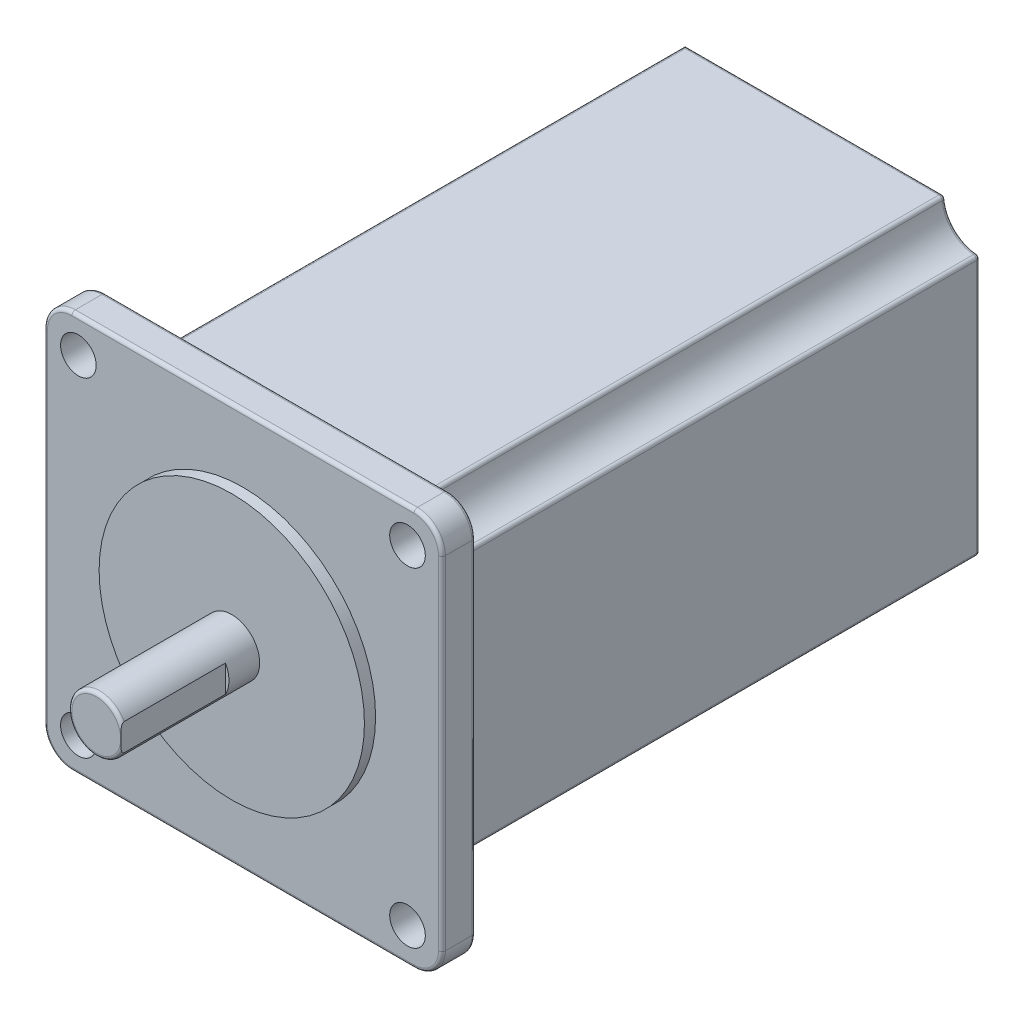
from build123d import *

# Parameters (mm, degrees)
IZIM1_R                     = 19.05
IZIM1_R_2                   = 2.55
IZIM1_R_3                   = 4
Y_KSEKLIK_EKSTR_ZYON1_DEPTH = 4.8
Y_KSEKLIK_EKSTR_ZYON2_DEPTH = 1.6
IZIM3_R                     = 4
Y_KSEKLIK_EKSTR_ZYON3_DEPTH = 19.4
KES_EKSTR_ZYON1_DEPTH       = 15
Y_KSEKLIK_EKSTR_ZYON4_DEPTH = 77.2
RADYUS1_R                   = 0.5


with BuildPart() as part:
    # Çizim1 → Yükseklik-Ekstrüzyon1 (new body)
    # profile 1 of 3: a face of its own
    with BuildSketch(Plane.XY):
        with BuildLine():
            Line((-34.313511383, 32.517298381), (14.686488617, 32.517298381))
            ThreePointArc((14.686488617, 32.517298381), (17.514915741, 31.345725506), (18.686488617, 28.517298381))
            Line((18.686488617, 28.517298381), (18.686488617, -20.482701619))
            ThreePointArc((18.686488617, -20.482701619), (17.514915741, -23.311128744), (14.686488617, -24.482701619))
            Line((14.686488617, -24.482701619), (-34.313511383, -24.482701619))
            ThreePointArc((-34.313511383, -24.482701619), (-37.141938508, -23.311128744), (-38.313511383, -20.482701619))
            Line((-38.313511383, -20.482701619), (-38.313511383, 28.517298381))
            ThreePointArc((-38.313511383, 28.517298381), (-37.141938508, 31.345725506), (-34.313511383, 32.517298381))
        make_face()
        with Locations((-9.813511383, 4.017298381)):
            Circle(IZIM1_R, mode=Mode.SUBTRACT)
        with Locations((13.756488617, 27.587298381)):
            Circle(IZIM1_R_2, mode=Mode.SUBTRACT)
        with Locations((13.756488617, -19.552701619)):
            Circle(IZIM1_R_2, mode=Mode.SUBTRACT)
        with Locations((-33.383511383, -19.552701619)):
            Circle(IZIM1_R_2, mode=Mode.SUBTRACT)
        with Locations((-33.383511383, 27.587298381)):
            Circle(IZIM1_R_2, mode=Mode.SUBTRACT)
    # profile 2 of 3: a face of its own
    with BuildSketch(Plane.XY):
        with Locations((-9.813511383, 4.017298381)):
            Circle(IZIM1_R)
        with Locations((-9.813511383, 4.017298381)):
            Circle(IZIM1_R_3, mode=Mode.SUBTRACT)
    # profile 3 of 3: a face of its own
    with BuildSketch(Plane.XY):
        with Locations((-9.813511383, 4.017298381)):
            Circle(IZIM1_R_3)
    extrude(amount=-Y_KSEKLIK_EKSTR_ZYON1_DEPTH)

    # Çizim2 → Yükseklik-Ekstrüzyon2 (add)
    with BuildSketch(Plane.XY):
        with BuildLine():
            ThreePointArc((9.186488617, 4.017298381), (3.621517459, 17.452327223), (-9.813511383, 23.017298381))
            Line((-9.813511383, 23.017298381), (-9.813511383, -14.982701619))
            ThreePointArc((-9.813511383, -14.982701619), (3.621517459, -9.417730462), (9.186488617, 4.017298381))
        make_face()
        with BuildLine():
            Line((-9.813511383, -14.982701619), (-9.813511383, 23.017298381))
            ThreePointArc((-9.813511383, 23.017298381), (-28.813511383, 4.017298381), (-9.813511383, -14.982701619))
        make_face()
    extrude(amount=Y_KSEKLIK_EKSTR_ZYON2_DEPTH)

    # Çizim3 → Yükseklik-Ekstrüzyon3 (add)
    with BuildSketch(Plane.XY.offset(1.6)):
        with Locations((-9.813511383, 4.017298381)):
            Circle(IZIM3_R)
    extrude(amount=Y_KSEKLIK_EKSTR_ZYON3_DEPTH)

    # Çizim4 → Kes-Ekstrüzyon1 (cut)
    with BuildSketch(Plane.XY.offset(21)):
        Polygon((-6.313511383, 4.017298381), (-6.313511383, 6.245974497), (-5.024546615, 6.245974497), (-5.024546615, 1.577201368), (-6.313511383, 1.577201368), align=None)
    extrude(amount=-KES_EKSTR_ZYON1_DEPTH, mode=Mode.SUBTRACT)

    # Çizim5 → Yükseklik-Ekstrüzyon4 (add)
    with BuildSketch(Plane(origin=(0, 0, -4.8), x_dir=(-1, 0, 0), z_dir=(0, 0, -1))):
        with BuildLine():
            ThreePointArc((-8.826488617, 27.587298381), (-10.270452185, 24.10126195), (-13.756488617, 22.657298381))
            Line((-13.756488617, 22.657298381), (-13.756488617, -14.622701619))
            ThreePointArc((-13.756488617, -14.622701619), (-10.270452185, -16.066665188), (-8.826488617, -19.552701619))
            Line((-8.826488617, -19.552701619), (28.453511383, -19.552701619))
            ThreePointArc((28.453511383, -19.552701619), (29.897474952, -16.066665188), (33.383511383, -14.622701619))
            Line((33.383511383, -14.622701619), (33.383511383, 22.657298381))
            ThreePointArc((33.383511383, 22.657298381), (29.897474952, 24.10126195), (28.453511383, 27.587298381))
            Line((28.453511383, 27.587298381), (-8.826488617, 27.587298381))
        make_face()
    extrude(amount=Y_KSEKLIK_EKSTR_ZYON4_DEPTH)

    # Radyus1
    radyus1_edges = [part.edges().sort_by_distance(p)[0] for p in [
        (-37.141938508, 31.345725506, -4.8),
        (-38.313511383, 4.017298381, -4.8),
        (-37.141938508, -23.311128744, -4.8),
        (-9.813511383, -24.482701619, -4.8),
        (17.514915741, -23.311128744, -4.8),
        (18.686488617, 4.017298381, -4.8),
        (17.514915741, 31.345725506, -4.8),
        (-37.141938508, 31.345725506, 0),
        (-38.313511383, 4.017298381, 0),
        (-37.141938508, -23.311128744, 0),
        (-9.813511383, -24.482701619, 0),
        (17.514915741, -23.311128744, 0),
        (18.686488617, 4.017298381, 0),
        (17.514915741, 31.345725506, 0),
        (-28.453511383, 27.587298381, -43.4),
        (-33.383511383, 22.657298381, -43.4),
        (-33.383511383, -14.622701619, -43.4),
        (-29.897474952, -16.066665188, -82),
        (-28.453511383, -19.552701619, -43.4),
        (-9.813511383, -19.552701619, -82),
        (10.270452185, -16.066665188, -82),
        (8.826488617, -19.552701619, -43.4),
        (13.756488617, -14.622701619, -43.4),
        (-9.813511383, 27.587298381, -82),
        (8.826488617, 27.587298381, -43.4),
        (10.270452185, 24.10126195, -82),
        (13.756488617, 22.657298381, -43.4),
        (13.756488617, 4.017298381, -82),
        (-13.813511383, 4.017298381, 21),
        (-9.813511383, 32.517298381, -4.8),
        (-9.813511383, 32.517298381, 0),
    ]]
    fillet(radyus1_edges, radius=RADYUS1_R - 0.0001)  # a hair under: the kernel refuses the full size


solid = part.part
